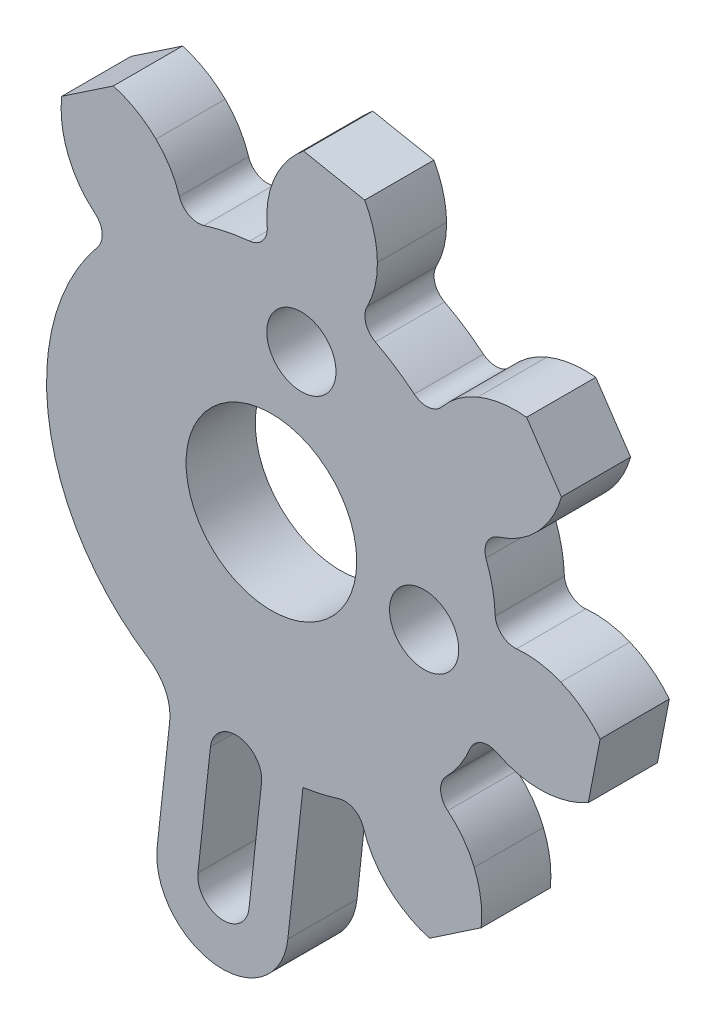
from build123d import *

# Parameters (mm, degrees)
ESQUISSE1_R               = 3.7
ESQUISSE1_R_2             = 1.5
T_LE_DE_BASE_PLI_E1_DEPTH = 3


# Sheet-metal steps are written as plain solids
with BuildPart() as part:
    # Esquisse1 → Tôle de base pliée1 (new body)
    with BuildSketch(Plane.XY):
        with BuildLine():
            Line((1343.247008076, 1938.302325501), (1345.89746161, 1937.787450694))
            ThreePointArc((1345.89746161, 1937.787450694), (1346.302249899, 1936.788677026), (1346.449670341, 1935.72112393))
            ThreePointArc((1346.449670341, 1935.72112393), (1346.342555269, 1934.751830987), (1346.001938932, 1933.838056967))
            ThreePointArc((1346.001938932, 1933.838056967), (1345.945060229, 1933.190654063), (1346.362467863, 1932.692520976))
            ThreePointArc((1346.362467863, 1932.692520976), (1347.233633787, 1932.178943437), (1348.046916436, 1931.57789162))
            ThreePointArc((1348.046916436, 1931.57789162), (1348.668588775, 1931.388447146), (1349.242230693, 1931.693898708))
            ThreePointArc((1349.242230693, 1931.693898708), (1349.950118086, 1932.364642987), (1350.800392256, 1932.842174436))
            ThreePointArc((1350.800392256, 1932.842174436), (1351.840616067, 1933.123842365), (1352.918151311, 1933.141736383))
            Line((1352.918151311, 1933.141736383), (1354.428233511, 1930.903511249))
            ThreePointArc((1354.428233511, 1930.903511249), (1354.008222422, 1929.911043071), (1353.357590382, 1929.051927044))
            ThreePointArc((1353.357590382, 1929.051927044), (1352.596454976, 1928.442275224), (1351.709467048, 1928.03699154))
            ThreePointArc((1351.709467048, 1928.03699154), (1351.211464748, 1927.619427873), (1351.154383232, 1926.97204282))
            ThreePointArc((1351.154383232, 1926.97204282), (1351.440459119, 1925.999644606), (1351.557306264, 1924.992795836))
            ThreePointArc((1351.557306264, 1924.992795836), (1351.862937519, 1924.419249637), (1352.48455048, 1924.229610418))
            ThreePointArc((1352.48455048, 1924.229610418), (1353.459390284, 1924.203346271), (1354.398290641, 1923.939777365))
            ThreePointArc((1354.398290641, 1923.939777365), (1355.333009255, 1923.403397357), (1356.107594714, 1922.65411786))
            Line((1356.107594714, 1922.65411786), (1355.592719908, 1920.003664327))
            ThreePointArc((1355.592719908, 1920.003664327), (1354.59394624, 1919.598876037), (1353.526393144, 1919.451455596))
            ThreePointArc((1353.526393144, 1919.451455596), (1352.557100201, 1919.558570667), (1351.643326181, 1919.899187005))
            ThreePointArc((1351.643326181, 1919.899187005), (1350.995923277, 1919.956065707), (1350.497790189, 1919.538658073))
            ThreePointArc((1350.497790189, 1919.538658073), (1350.024286618, 1918.640974498), (1349.383160833, 1917.854209501))
            ThreePointArc((1349.383160833, 1917.854209501), (1349.19371636, 1917.232537161), (1349.499167922, 1916.658895244))
            ThreePointArc((1349.499167922, 1916.658895244), (1350.169912201, 1915.951007851), (1350.64744365, 1915.100733681))
            ThreePointArc((1350.64744365, 1915.100733681), (1350.929111579, 1914.06050987), (1350.947005597, 1912.982974625))
            Line((1350.947005597, 1912.982974625), (1348.708780463, 1911.472892426))
            ThreePointArc((1348.708780463, 1911.472892426), (1347.716312285, 1911.892903515), (1346.857196258, 1912.543535554))
            ThreePointArc((1346.857196258, 1912.543535554), (1346.247544438, 1913.304670961), (1345.842260754, 1914.191658889))
            ThreePointArc((1345.842260754, 1914.191658889), (1345.424697087, 1914.689661189), (1344.777312034, 1914.746742704))
            ThreePointArc((1344.777312034, 1914.746742704), (1344.006653047, 1914.538715485), (1343.221559749, 1914.394427185))
            Line((1343.221559749, 1914.394427185), (1342.565641761, 1908.368090699))
            ThreePointArc((1342.565641761, 1908.368090699), (1339.42399637, 1905.843201744), (1336.899107414, 1908.984847135))
            Line((1336.899107414, 1908.984847135), (1337.442443377, 1913.976820816))
            ThreePointArc((1337.442443377, 1913.976820816), (1337.260922483, 1915.05095745), (1336.54337922, 1915.870622631))
            ThreePointArc((1336.54337922, 1915.870622631), (1332.217504298, 1922.559333364), (1334.323234317, 1930.241647222))
            ThreePointArc((1334.323234317, 1930.241647222), (1334.51267879, 1930.863319562), (1334.207227229, 1931.436961479))
            ThreePointArc((1334.207227229, 1931.436961479), (1333.536482949, 1932.144848872), (1333.0589515, 1932.995123042))
            ThreePointArc((1333.0589515, 1932.995123042), (1332.777283571, 1934.035346853), (1332.759389553, 1935.112882097))
            Line((1332.759389553, 1935.112882097), (1334.997614687, 1936.622964297))
            ThreePointArc((1334.997614687, 1936.622964297), (1335.990082865, 1936.202953208), (1336.849198892, 1935.552321168))
            ThreePointArc((1336.849198892, 1935.552321168), (1337.458850712, 1934.791185762), (1337.864134396, 1933.904197834))
            ThreePointArc((1337.864134396, 1933.904197834), (1338.281698063, 1933.406195534), (1338.929083116, 1933.349114018))
            ThreePointArc((1338.929083116, 1933.349114018), (1339.908244608, 1933.601967191), (1340.9083301, 1933.752037051))
            ThreePointArc((1340.9083301, 1933.752037051), (1341.481876299, 1934.057668306), (1341.671515518, 1934.679281266))
            ThreePointArc((1341.671515518, 1934.679281266), (1341.697779666, 1935.65412107), (1341.961348571, 1936.593021428))
            ThreePointArc((1341.961348571, 1936.593021428), (1342.497728579, 1937.527740041), (1343.247008076, 1938.302325501))
        make_face()
        with Locations((1341.853197575, 1924.047928361)):
            Circle(ESQUISSE1_R, mode=Mode.SUBTRACT)
        with Locations((1343.153024926, 1930.717446866)):
            Circle(ESQUISSE1_R_2, mode=Mode.SUBTRACT)
        with Locations((1348.476026591, 1922.946328291)):
            Circle(ESQUISSE1_R_2, mode=Mode.SUBTRACT)
        with BuildLine():
            Line((1340.880246952, 1908.666985015), (1341.425079269, 1913.672706653))
            ThreePointArc((1341.425079269, 1913.672706653), (1340.438549544, 1914.900216702), (1339.211039495, 1913.913686977))
            Line((1339.211039495, 1913.913686977), (1338.666207179, 1908.907965339))
            ThreePointArc((1338.666207179, 1908.907965339), (1339.652736904, 1907.68045529), (1340.880246952, 1908.666985015))
        make_face(mode=Mode.SUBTRACT)
    extrude(amount=-T_LE_DE_BASE_PLI_E1_DEPTH)


solid = part.part
